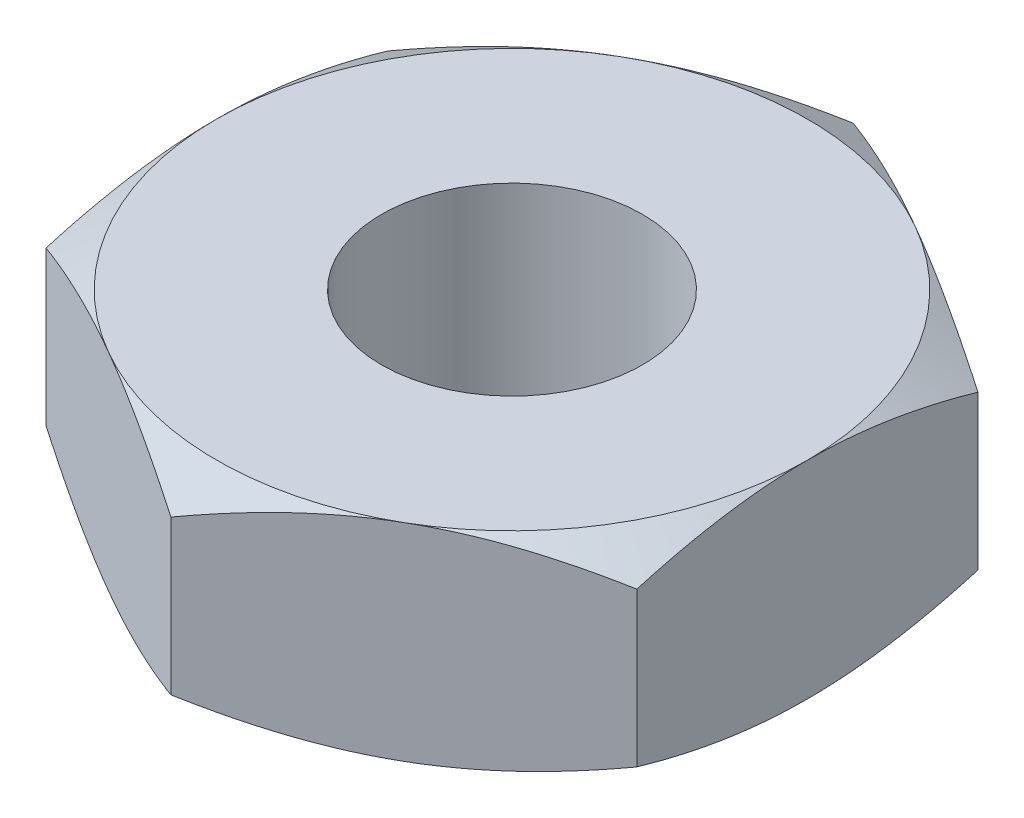
from build123d import *

# Parameters (mm, degrees)
SKETCH1_R               = 1.7526
BOSS_EXTRUDE1_DEPTH     = 1.3890625
SKETCH5_OUTSIDE_W       = 38.99
SKETCH5_OUTSIDE_H       = 40.218
SKETCH5_OUTSIDE_R       = 3.96875
CUT_EXTRUDE2_DEPTH      = 7.668602339
CUT_EXTRUDE2_DRAFT      = -60
MIRROR1_COPY_1_SKETCH_W = 38.99
MIRROR1_COPY_1_SKETCH_H = 40.218
MIRROR1_COPY_1_SKETCH_R = 3.96875
MIRROR1_COPY_1_DEPTH    = 7.668602339
MIRROR1_COPY_1_DRAFT    = -60


with BuildPart() as part:
    # Sketch1 → Boss-Extrude1 (new, symmetric)
    with BuildSketch(Plane(origin=(0, 0, 0), x_dir=(1, 0, 0), z_dir=(0, 1, 0))):
        Polygon((-3.96875, 2.291358881), (-3.96875, -2.291358881), (0, -4.582717762), (3.96875, -2.291358881), (3.96875, 2.291358881), (0, 4.582717762), align=None)
        Circle(SKETCH1_R, mode=Mode.SUBTRACT)
    extrude(amount=BOSS_EXTRUDE1_DEPTH, both=True)


with BuildPart() as cut_extrude2_tool:
    # Sketch5 outside → Cut-Extrude2 (with draft: the straight prism first)
    with BuildSketch(Plane(origin=(0, 1.3890625, 0), x_dir=(1, 0, 0), z_dir=(0, 1, 0))):
        Rectangle(SKETCH5_OUTSIDE_W, SKETCH5_OUTSIDE_H)
        Circle(SKETCH5_OUTSIDE_R, mode=Mode.SUBTRACT)
    extrude(amount=-CUT_EXTRUDE2_DEPTH)
    # Cut-Extrude2: the draft: its side faces are tilted about the plane it starts from
    cut_extrude2_sides = [cut_extrude2_tool.faces().sort_by_distance(p)[0] for p in [
        (0, -2.44523867, 20.109),
        (19.495, -2.44523867, 0),
        (0, -2.44523867, -20.109),
        (-19.495, -2.44523867, 0),
        (-3.96875, -2.44523867, 0),
    ]]
    draft(cut_extrude2_sides, Plane(origin=(0, 1.3890625, 0), x_dir=(1, 0, 0), z_dir=(0, 1, 0)), CUT_EXTRUDE2_DRAFT)


with BuildPart() as part_1:
    add(part.part)

    # Cut-Extrude2: cut by cut_extrude2_tool
    add(cut_extrude2_tool.part, mode=Mode.SUBTRACT)


with BuildPart() as mirror1_copy_1_tool:
    # Mirror1 copy 1 sketch → Mirror1 copy 1 (with draft: the straight prism first)
    with BuildSketch(Plane.XZ.offset(1.3890625)):
        Rectangle(MIRROR1_COPY_1_SKETCH_W, MIRROR1_COPY_1_SKETCH_H)
        Circle(MIRROR1_COPY_1_SKETCH_R, mode=Mode.SUBTRACT)
    extrude(amount=-MIRROR1_COPY_1_DEPTH)
    # Mirror1 copy 1: the draft: its side faces are tilted about the plane it starts from
    mirror1_copy_1_sides = [mirror1_copy_1_tool.faces().sort_by_distance(p)[0] for p in [
        (0, 2.44523867, 20.109),
        (19.495, 2.44523867, 0),
        (0, 2.44523867, -20.109),
        (-19.495, 2.44523867, 0),
        (-3.96875, 2.44523867, 0),
    ]]
    draft(mirror1_copy_1_sides, Plane.XZ.offset(1.3890625), MIRROR1_COPY_1_DRAFT)


with BuildPart() as part_2:
    add(part_1.part)

    # Mirror1 copy 1: cut by mirror1_copy_1_tool
    add(mirror1_copy_1_tool.part, mode=Mode.SUBTRACT)


solid = part_2.part
